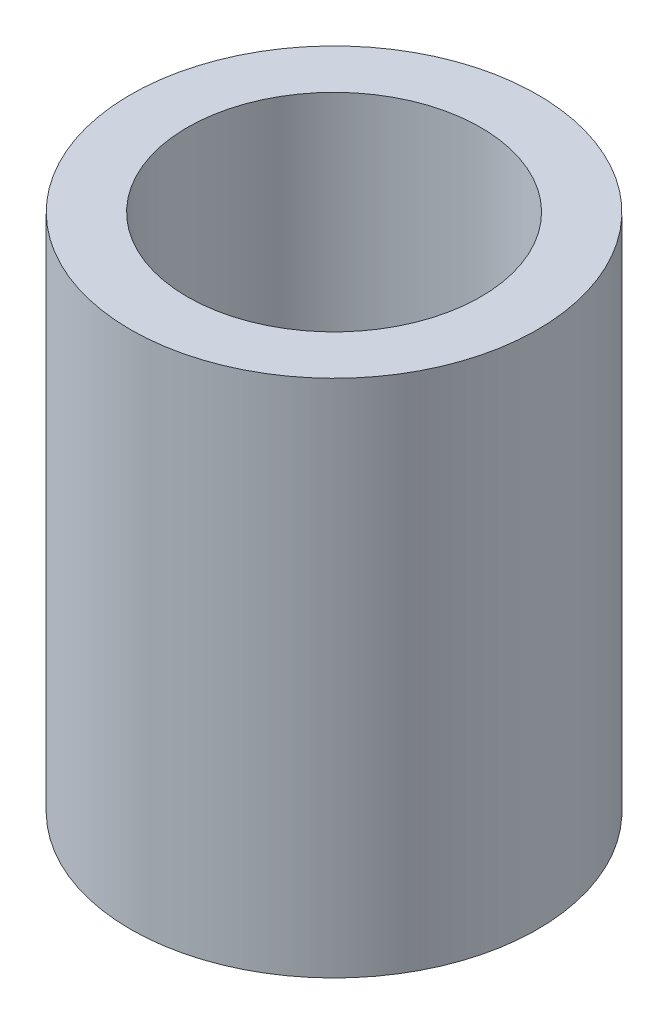
from build123d import *

# Parameters (mm, degrees)
SKETCH1_R           = 20
BOSS_EXTRUDE1_DEPTH = 51.034399499
SKETCH2_R           = 14.418701748
CUT_EXTRUDE1_DEPTH  = 59.348178482


with BuildPart() as part:
    # Sketch1 → Boss-Extrude1 (new body)
    with BuildSketch(Plane(origin=(0, 0, 0), x_dir=(1, 0, 0), z_dir=(0, 1, 0))):
        Circle(SKETCH1_R)
    extrude(amount=BOSS_EXTRUDE1_DEPTH)

    # Sketch2 → Cut-Extrude1 (cut, through all)
    with BuildSketch(Plane(origin=(0, 0, 0), x_dir=(1, 0, 0), z_dir=(0, 1, 0))):
        Circle(SKETCH2_R)
    extrude(amount=CUT_EXTRUDE1_DEPTH, mode=Mode.SUBTRACT)


solid = part.part
